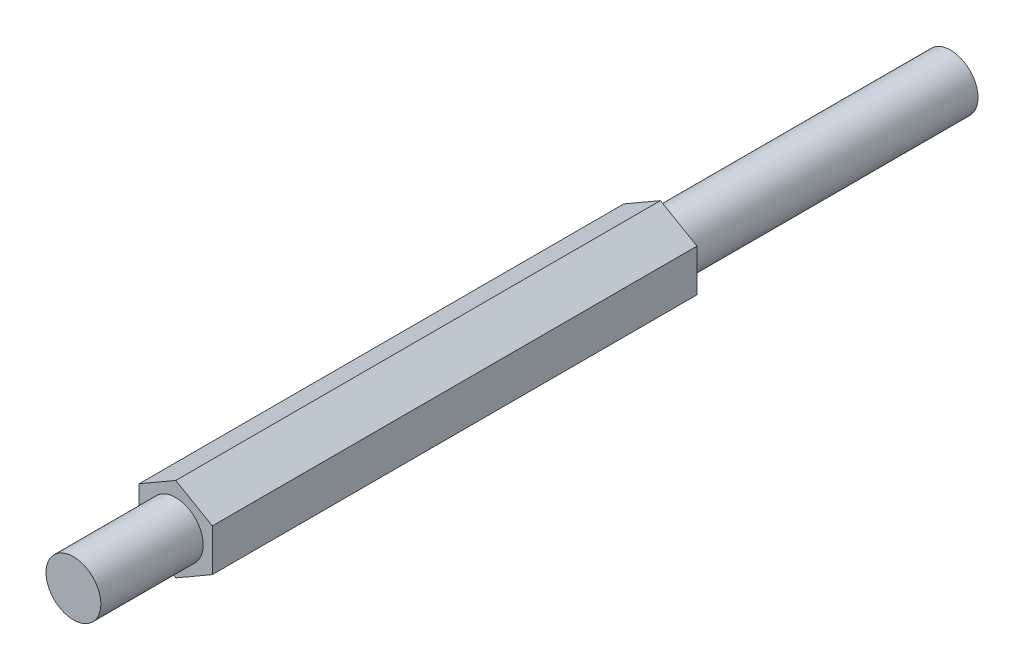
from build123d import *

# Parameters (mm, degrees)
BOSS_EXTRUDE1_DEPTH      = 116.84
BOSS_EXTRUDE1_DEPTH_BACK = 51.562
SKETCH1_3_R              = 9.525
BOSS_EXTRUDE2_DEPTH      = 152.4


with BuildPart() as part:
    # Sketch1 → Boss-Extrude1 (new, two sides: drawn at the far end of the back side and taken through both)
    with BuildSketch(Plane.XY.offset(-BOSS_EXTRUDE1_DEPTH_BACK)):
        Polygon((-12.7, -7.332348419), (0, -14.664696837), (12.7, -7.332348419), (12.7, 7.332348419), (0, 14.664696837), (-12.7, 7.332348419), align=None)
    extrude(amount=BOSS_EXTRUDE1_DEPTH + BOSS_EXTRUDE1_DEPTH_BACK)

    # Sketch1<3> → Boss-Extrude2 (add, symmetric)
    with BuildSketch(Plane.XY):
        Circle(SKETCH1_3_R)
    extrude(amount=BOSS_EXTRUDE2_DEPTH, both=True)


solid = part.part
